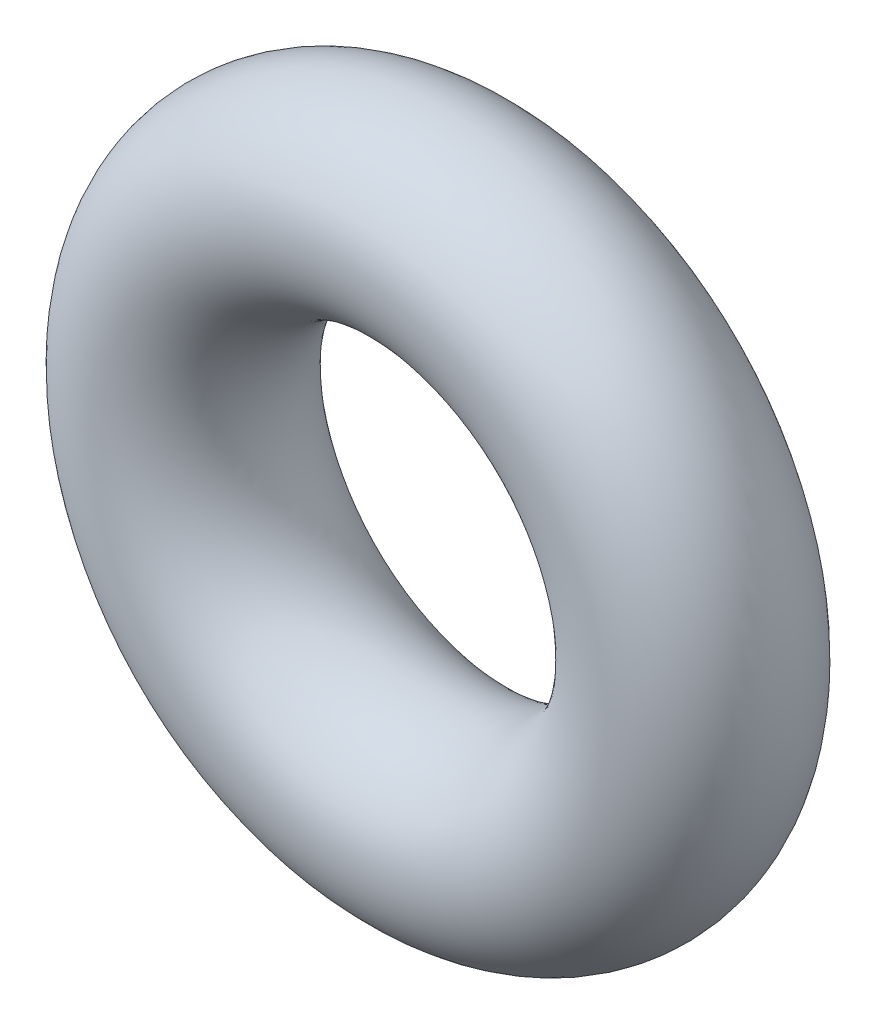
from build123d import *

# Parameters (mm, degrees)
SKETCH1_R = 0.889


with BuildPart() as part:
    # Sketch1 → Revolve1 (revolve)
    with BuildSketch(Plane(origin=(0, 0, 0), x_dir=(0, 0, -1), z_dir=(1, 0, 0))):
        with Locations((0, 2.3368)):
            Circle(SKETCH1_R)
    revolve(axis=Axis((0, 0, 0), (0, 0, -1)))


solid = part.part
